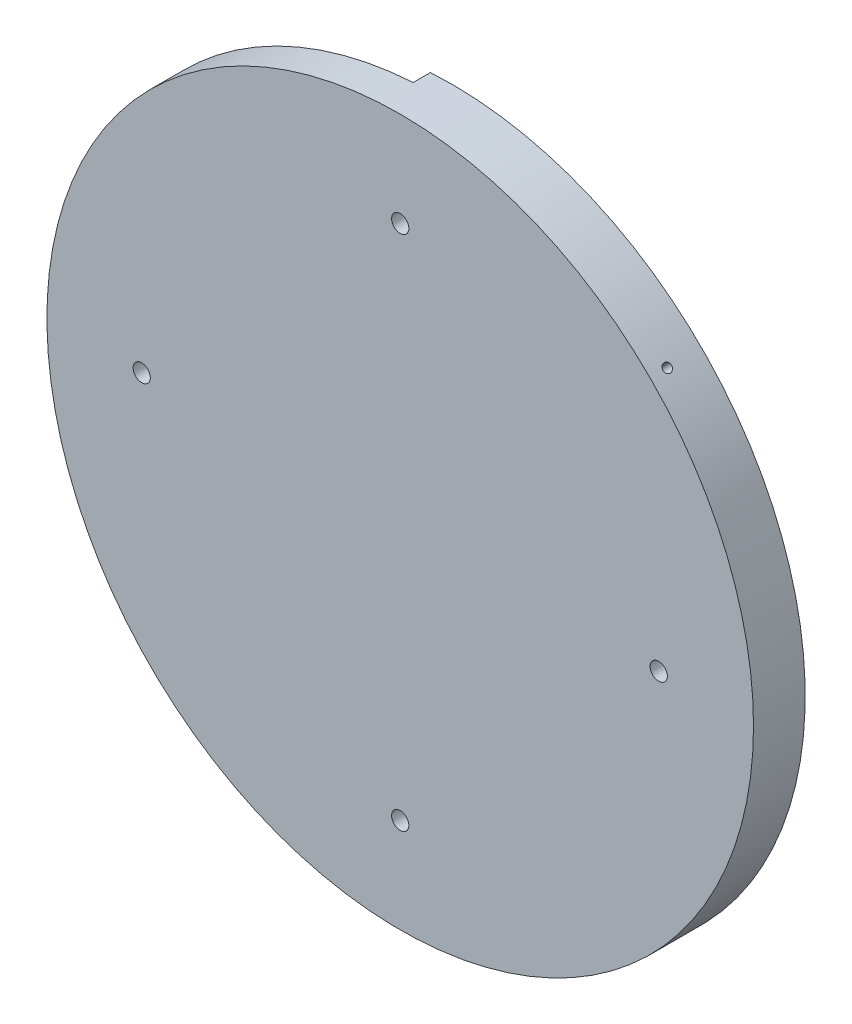
from build123d import *
from build123d.topology import SkipClean

# Parameters (mm, degrees)
SKETCH1_R           = 82
BOSS_EXTRUDE1_DEPTH = 8
BOSS_EXTRUDE3_START = 4
BOSS_EXTRUDE3_DEPTH = 4
FILLET1_R           = 10
SKETCH2_R           = 2
CUT_EXTRUDE1_DEPTH  = 15
CIRPATTERN2_COUNT   = 4
CUT_EXTRUDE3_DEPTH  = 3.2
CIRPATTERN3_COUNT   = 4
SKETCH8_R           = 1
CUT_EXTRUDE4_DEPTH  = 12
CIRPATTERN4_COUNT   = 4


with BuildPart() as part:
    # Sketch1 → Boss-Extrude1 (new body)
    with BuildSketch(Plane.XY):
        Circle(SKETCH1_R)
    extrude(amount=BOSS_EXTRUDE1_DEPTH)

    # Sketch3 → Boss-Extrude3 (add)
    with BuildSketch(Plane(origin=(0, 0, 0), x_dir=(-1, 0, 0), z_dir=(0, 0, -1)).offset(BOSS_EXTRUDE3_START)):
        with BuildLine():
            Line((5, 81.847419019), (5, 75.334255157))
            ThreePointArc((5, 75.334255157), (-75.5, 0), (5, -75.334255157))
            Line((5, -75.334255157), (5, -81.847419019))
            ThreePointArc((5, -81.847419019), (-82, 0), (5, 81.847419019))
        make_face()
    extrude(amount=-BOSS_EXTRUDE3_DEPTH)

    # Fillet1
    # the kernel refuses this fillet: 10 mm, written as the material it takes off along each edge
    with BuildSketch(Plane(origin=(-5, 75.334255157, -26.107668238), x_dir=(0, 1, 0), z_dir=(0, 0, 1))) as fillet1_piece_1:
        with BuildLine():
            CenterArc((10.054924154, -9.351787745), FILLET1_R, 110.742953573, 66.339539365)
            ThreePointArc((0.067885639, -8.842806722), (0.163520134, -4.420408605), (0, 0))
            Line((0, 0), (6.513163862, 0))
        make_face()
    extrude(amount=26.107668238, mode=Mode.SUBTRACT)
    with BuildSketch(Plane(origin=(-5, -75.334255157, -26.107668238), x_dir=(0, -1, 0), z_dir=(0, 0, 1))) as fillet1_piece_2:
        with BuildLine():
            CenterArc((10.054924154, 9.351787745), FILLET1_R, 182.917507062, 66.339539365)
            ThreePointArc((0.067885639, 8.842806722), (0.163520134, 4.420408605), (0, 0))
            Line((0, 0), (6.513163862, 0))
        make_face()
    extrude(amount=26.107668238, mode=Mode.SUBTRACT)

    # Sketch2 → Cut-Extrude1 (cut)
    with BuildSketch(Plane.XY.offset(8)):
        with Locations((0, 60)):
            Circle(SKETCH2_R)
    cut_extrude1 = extrude(amount=-CUT_EXTRUDE1_DEPTH, mode=Mode.SUBTRACT)

    # CirPattern2: Cut-Extrude1 ×4 about axis
    cirpattern2_axis = Axis((0, 0, 0), (0, 0, 1))
    for i in range(1, CIRPATTERN2_COUNT):
        add(cut_extrude1.rotate(cirpattern2_axis, i * 360 / CIRPATTERN2_COUNT), mode=Mode.SUBTRACT)

    # Sketch7 → Cut-Extrude3 (cut)
    with BuildSketch(Plane(origin=(0, 0, 0), x_dir=(-1, 0, 0), z_dir=(0, 0, -1))):
        Polygon((1.788462671, 63.624187441), (-2.244407056, 63.360947827), (-4.032869728, 59.736760386), (-1.788462671, 56.375812559), (2.244407056, 56.639052173), (4.032869728, 60.263239614), align=None)
    cut_extrude3 = extrude(amount=-CUT_EXTRUDE3_DEPTH, mode=Mode.SUBTRACT)

    # CirPattern3: Cut-Extrude3 ×4 about axis
    cirpattern3_axis = Axis((0, 0, 0), (0, 0, 1))
    for i in range(1, CIRPATTERN3_COUNT):
        add(cut_extrude3.rotate(cirpattern3_axis, i * 360 / CIRPATTERN3_COUNT), mode=Mode.SUBTRACT)

    # Sketch8 → Cut-Extrude4 (cut)
    with BuildSketch(Plane(origin=(-57.982756057, 57.982756057, 0), x_dir=(0.7071067811865477, 0.7071067811865475, 0), z_dir=(-0.7071067811865475, 0.7071067811865477, 0))):
        with Locations(Location((0, -4, 0), (0, 0, 180))):
            Circle(SKETCH8_R)
    cut_extrude4 = extrude(amount=-CUT_EXTRUDE4_DEPTH, mode=Mode.SUBTRACT)

    # CirPattern4: Cut-Extrude4 ×4 about axis
    with SkipClean():  # the faces are left unmerged after this step: merging them gives an invalid solid
        cirpattern4_axis = Axis((0, 0, 0), (0, 0, 1))
        for i in range(1, CIRPATTERN4_COUNT):
            add(cut_extrude4.rotate(cirpattern4_axis, i * 360 / CIRPATTERN4_COUNT), mode=Mode.SUBTRACT)


solid = part.part
